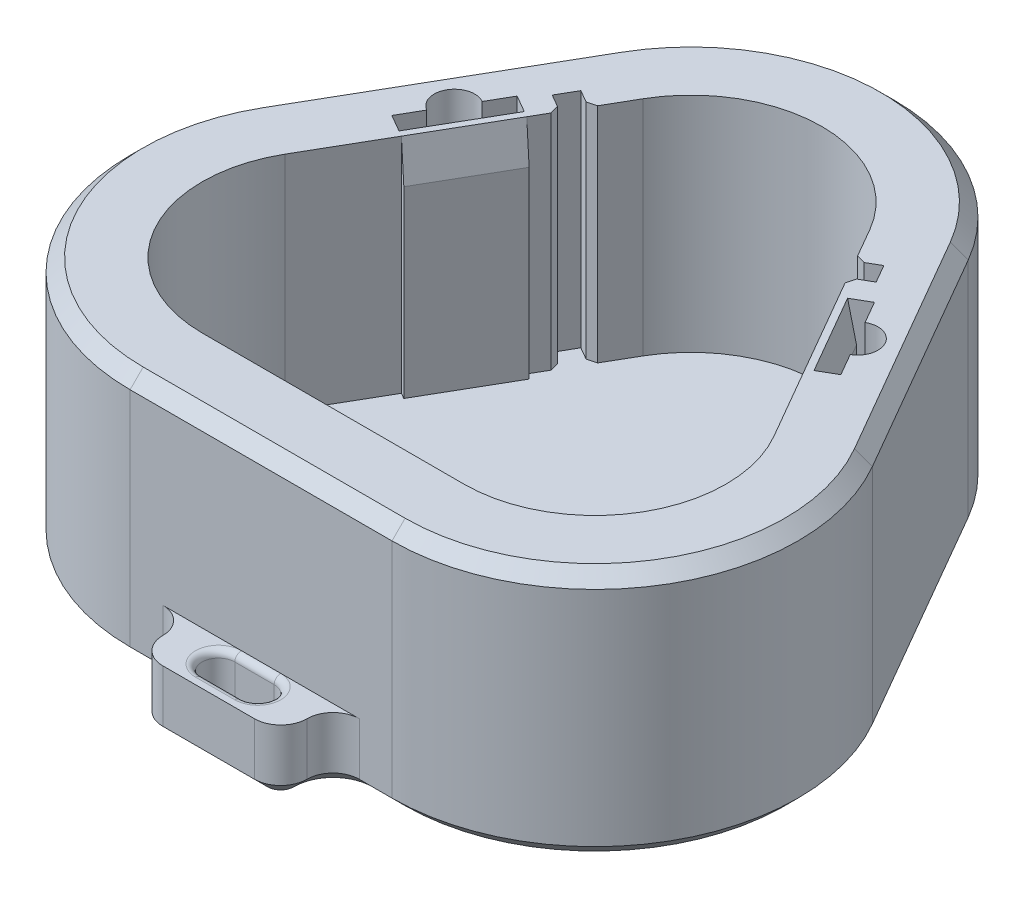
from build123d import *

# Parameters (mm, degrees)
BOSS_EXTRUDE1_DEPTH = 17
CHAMFER1_SIZE       = 0.5
CUT_EXTRUDE1_DEPTH  = 13
BOSS_EXTRUDE2_START = -2
BOSS_EXTRUDE2_DEPTH = 2
SKETCH2_R           = 1.5499999999999992
SKETCH2_R_2         = 1.550000000000003
SKETCH2_R_3         = 2.5
CUT_EXTRUDE2_DEPTH  = 2
BOSS_EXTRUDE3_DEPTH = 5
FILLET1_R           = 2
FILLET2_R           = 0.5
CHAMFER3_SIZE       = 0.5
CHAMFER3_SIZE2      = 3
CHAMFER4_SIZE       = 1


with BuildPart() as part:
    # Sketch1 → Boss-Extrude1 (new body)
    with BuildSketch(Plane(origin=(0, 0, 0), x_dir=(1, 0, 0), z_dir=(0, 1, 0))):
        with BuildLine():
            ThreePointArc((13.418634843133532, 19.2879126019326), (5.33e-15, 27.035165040773038), (-13.418634843133521, 19.287912601932604))
            Line((-13.418634843133521, 19.2879126019326), (-23.413139720814414, 1.9769223572943453))
            ThreePointArc((-23.413139720814414, 1.976922357294347), (-23.413139720814407, -13.517582520386524), (-9.994504877680875, -21.264834959226956))
            Line((-9.994504877680875, -21.264834959226956), (9.994504877680878, -21.26483495922696))
            ThreePointArc((9.994504877680878, -21.26483495922696), (23.413139720814414, -13.517582520386526), (23.41313972081442, 1.9769223572943506))
            Line((23.41313972081442, 1.9769223572943488), (13.418634843133532, 19.2879126019326))
        make_face()
        with BuildLine():
            Line((-11.469734859267339, 10.663506392859015), (-11.902747561159552, 10.91350639285901))
            Line((-11.902747561159554, 10.91350639285901), (-10.975952641916443, 12.518762281184774))
            Line((-10.975952641916448, 12.518762281184776), (-12.361593287971548, 13.318762281184778))
            Line((-12.361593287971548, 13.318762281184778), (-11.561593287971546, 14.70440292723988))
            Line((-11.561593287971546, 14.70440292723988), (-10.17595264191644, 13.904402927239877))
            Line((-10.175952641916442, 13.904402927239877), (-8.655495122319113, 16.537912601932604))
            ThreePointArc((-8.655495122319113, 16.537912601932604), (1.33e-15, 21.535165040773038), (8.655495122319117, 16.537912601932604))
            Line((8.655495122319117, 16.537912601932604), (10.175952641916444, 13.904402927239877))
            Line((10.175952641916444, 13.904402927239877), (11.561593287971549, 14.70440292723988))
            Line((11.561593287971549, 14.70440292723988), (12.361593287971552, 13.318762281184778))
            Line((12.361593287971552, 13.318762281184778), (10.975952641916452, 12.518762281184776))
            Line((10.975952641916447, 12.518762281184772), (11.902747561159558, 10.91350639285901))
            Line((11.902747561159556, 10.913506392859007), (11.46973485926734, 10.663506392859015))
            Line((11.46973485926734, 10.663506392859015), (14.969734859267339, 4.601328566367944))
            Line((14.969734859267339, 4.601328566367944), (15.402747561159552, 4.851328566367944))
            Line((15.402747561159552, 4.8513285663679415), (18.64999999999999, -0.7730776427056512))
            ThreePointArc((18.64999999999999, -0.7730776427056494), (18.65, -10.767582520386522), (9.994504877680878, -15.764834959226958))
            Line((9.994504877680878, -15.76483495922696), (-9.994504877680871, -15.76483495922696))
            ThreePointArc((-9.994504877680868, -15.76483495922696), (-18.64999999999999, -10.767582520386524), (-18.64999999999999, -0.7730776427056494))
            Line((-18.64999999999999, -0.7730776427056512), (-15.402747561159547, 4.851328566367947))
            Line((-15.40274756115955, 4.851328566367947), (-14.969734859267337, 4.601328566367946))
            Line((-14.969734859267337, 4.601328566367946), (-11.469734859267339, 10.663506392859015))
        make_face(mode=Mode.SUBTRACT)
        with BuildLine():
            Line((13.63479836872844, 11.913506392859018), (14.609798368728441, 10.224756855479358))
            ThreePointArc((14.609798368728436, 10.224756855479354), (16.727137744594316, 9.657417479613473), (16.159798368728428, 7.540078103747593))
            Line((16.15979836872844, 7.5400781037476), (17.13479836872844, 5.851328566367942))
            Line((17.13479836872844, 5.851328566367942), (16.268772964944, 5.351328566367942))
            Line((16.268772964944, 5.351328566367942), (12.768772964944, 11.413506392859018))
            Line((12.768772964944, 11.413506392859018), (13.63479836872844, 11.913506392859018))
        make_face(mode=Mode.SUBTRACT)
        with BuildLine():
            Line((-13.634798368728436, 11.913506392859018), (-12.768772964943997, 11.413506392859018))
            Line((-12.768772964943997, 11.413506392859018), (-16.268772964944, 5.351328566367942))
            Line((-16.268772964944, 5.351328566367942), (-17.13479836872844, 5.851328566367942))
            Line((-17.13479836872844, 5.851328566367942), (-16.159798368728442, 7.540078103747597))
            ThreePointArc((-16.159798368728435, 7.540078103747593), (-16.727137744594312, 9.65741747961347), (-14.60979836872844, 10.224756855479354))
            Line((-14.609798368728441, 10.224756855479356), (-13.634798368728436, 11.913506392859018))
        make_face(mode=Mode.SUBTRACT)
    extrude(amount=BOSS_EXTRUDE1_DEPTH)

    # Chamfer1
    chamfer1_edges = [part.edges().sort_by_distance(p)[0] for p in [
        (-10.175952641916442, 8.5, -13.904402927239877),
        (-10.975952641916447, 8.5, -12.518762281184774),
        (10.97595264191645, 8.5, -12.518762281184774),
        (10.175952641916444, 8.5, -13.904402927239877),
    ]]
    chamfer(chamfer1_edges, length=CHAMFER1_SIZE)

    # Sketch1<3> → Cut-Extrude1 (cut)
    with BuildSketch(Plane(origin=(0, 0, 0), x_dir=(1, 0, 0), z_dir=(0, 1, 0))):
        Polygon((-12.585760263051778, 10.7304936909668), (-13.018772964943997, 10.9804936909668), (-13.518772964943999, 10.114468287182358), (-13.085760263051776, 9.86446828718236), align=None)
        Polygon((-15.08576026305178, 6.400366672044599), (-15.518772964944, 6.650366672044602), (-16.018772964944, 5.784341268260162), (-15.585760263051782, 5.53434126826016), align=None)
        Polygon((13.518772964944, 10.114468287182358), (13.018772964944, 10.9804936909668), (12.585760263051782, 10.7304936909668), (13.08576026305178, 9.86446828718236), align=None)
        Polygon((16.018772964944, 5.784341268260162), (15.518772964944, 6.6503666720445995), (15.085760263051784, 6.400366672044599), (15.585760263051785, 5.53434126826016), align=None)
    extrude(amount=CUT_EXTRUDE1_DEPTH, mode=Mode.SUBTRACT)

    # Sketch1<4> → Boss-Extrude2 (add)
    with BuildSketch(Plane(origin=(0, 0, 0), x_dir=(1, 0, 0), z_dir=(0, 1, 0)).offset(BOSS_EXTRUDE2_START)):
        with BuildLine():
            Line((-13.418634843133521, 19.2879126019326), (-23.413139720814414, 1.976922357294346))
            ThreePointArc((-23.413139720814414, 1.976922357294346), (-23.413139720814407, -13.517582520386522), (-9.994504877680875, -21.264834959226956))
            Line((-9.994504877680875, -21.264834959226956), (9.994504877680878, -21.26483495922696))
            ThreePointArc((9.994504877680878, -21.26483495922696), (23.413139720814414, -13.517582520386522), (23.41313972081442, 1.9769223572943484))
            Line((23.41313972081442, 1.9769223572943484), (13.418634843133532, 19.2879126019326))
            ThreePointArc((13.418634843133532, 19.2879126019326), (3.63e-15, 27.035165040773038), (-13.418634843133521, 19.2879126019326))
        make_face()
    extrude(amount=BOSS_EXTRUDE2_DEPTH)

    # Sketch2 → Cut-Extrude2 (cut)
    # profile 1 of 4: a face of its own
    with BuildSketch(Plane.XZ.offset(2)):
        with Locations(Location((-15.384798368728436, -8.882417479613482, 0), (0, 0, 270))):
            Circle(SKETCH2_R)
    # profile 2 of 4: a face of its own
    with BuildSketch(Plane.XZ.offset(2)):
        with Locations(Location((15.38479836872844, -8.882417479613482, 0), (0, 0, 270))):
            Circle(SKETCH2_R_2)
    # profile 3 of 4: a face of its own
    with BuildSketch(Plane.XZ.offset(2)):
        with Locations(Location((0, 0, 0), (0, 0, 270))):
            Circle(SKETCH2_R_3)
    # profile 4 of 4: a face of its own
    with BuildSketch(Plane.XZ.offset(2)):
        Polygon((5.499999999999999, 21.264834959226956), (5.5, 25.264834959226956), (-5.5, 25.264834959226956), (-5.499999999999999, 21.264834959226956), align=None)
        with BuildLine():
            Line((-1.4999999999999987, 24.264834959226945), (1.4999999999999987, 24.264834959226945))
            ThreePointArc((1.4999999999999987, 24.264834959226945), (2.7499999999999916, 23.014834959226953), (1.4999999999999987, 21.76483495922696))
            Line((1.4999999999999987, 21.76483495922696), (-1.4999999999999987, 21.76483495922696))
            ThreePointArc((-1.4999999999999987, 21.76483495922696), (-2.7499999999999916, 23.014834959226953), (-1.4999999999999987, 24.264834959226945))
        make_face(mode=Mode.SUBTRACT)
    extrude(amount=-CUT_EXTRUDE2_DEPTH, mode=Mode.SUBTRACT)

    # Sketch2<2> → Boss-Extrude3 (add)
    with BuildSketch(Plane.XZ.offset(2)):
        Polygon((-5.499999999999999, 21.264834959226956), (5.499999999999999, 21.264834959226956), (5.5, 25.264834959226956), (-5.5, 25.264834959226956), align=None)
        with BuildLine():
            ThreePointArc((-1.499999999999999, 21.76483495922696), (-2.7499999999999916, 23.014834959226953), (-1.4999999999999987, 24.264834959226945))
            Line((-1.4999999999999987, 24.264834959226945), (1.4999999999999987, 24.264834959226945))
            ThreePointArc((1.499999999999999, 24.264834959226945), (2.7499999999999916, 23.014834959226953), (1.4999999999999987, 21.76483495922696))
            Line((1.4999999999999987, 21.76483495922696), (-1.4999999999999987, 21.76483495922696))
        make_face(mode=Mode.SUBTRACT)
    extrude(amount=-BOSS_EXTRUDE3_DEPTH)

    # Fillet1
    fillet1_edges = [part.edges().sort_by_distance(p)[0] for p in [
        (5.499999999999999, 0.5, 21.264834959226956),
        (-5.499999999999999, 0.5, 21.264834959226956),
    ]]
    fillet(fillet1_edges, radius=FILLET1_R)
    fillet1_2_edges = [part.edges().sort_by_distance(p)[0] for p in [
        (5.5, 0.5, 25.264834959226956),
        (-5.5, 0.5, 25.264834959226956),
    ]]
    fillet(fillet1_2_edges, radius=FILLET1_R - 0.0001)  # a hair under: the kernel refuses the full size

    # Fillet2
    fillet2_edges = [part.edges().sort_by_distance(p)[0] for p in [
        (0, 3, 24.264834959226945),
        (2.7499999999999916, 3, 23.014834959226953),
        (-2.7499999999999916, 3, 23.014834959226953),
        (0, 3, 21.76483495922696),
    ]]
    fillet(fillet2_edges, radius=FILLET2_R - 0.0001)  # a hair under: the kernel refuses the full size

    # Chamfer3
    chamfer3_edges = [part.edges().sort_by_distance(p)[0] for p in [
        (13.21973485926734, 17, -7.63241747961348),
        (-13.219734859267337, 17, -7.63241747961348),
        (14.518772964943999, 17, -8.38241747961348),
        (-14.518772964943999, 17, -8.38241747961348),
    ]]
    chamfer3_side = [part.faces().sort_by_distance(p)[0] for p in [
        (-12.172522474712478, 17, -11.850756469441762),
    ]]
    chamfer(chamfer3_edges, length=CHAMFER3_SIZE, length2=CHAMFER3_SIZE2, reference=chamfer3_side[0])

    # Chamfer4
    chamfer4_edges = [part.edges().sort_by_distance(p)[0] for p in [
        (1.78e-15, 17, 21.26483495922696),
        (23.413139720814414, 17, 13.517582520386522),
        (18.415887281973976, 17, -10.632417479613474),
        (4.44e-15, 17, -27.035165040773038),
        (-18.415887281973966, 17, -10.632417479613473),
        (-23.413139720814407, 17, 13.517582520386526),
        (5.33e-15, -2, -27.035165040773038),
        (23.413139720814414, -2, 13.517582520386526),
        (-8.747252438840437, -2, 21.264834959226956),
        (-23.413139720814407, -2, 13.517582520386524),
        (-18.415887281973966, -2, -10.632417479613473),
        (18.415887281973976, -2, -10.632417479613474),
        (8.747252438840441, -2, 21.26483495922696),
        (0, -2, 25.264834959226956),
        (-4.9142428516949765, -2, 24.67907781092193),
        (4.914242851694976, -2, 24.67907781092193),
        (6.085786437626905, -2, 21.850621396853864),
        (-6.085786437626905, -2, 21.85062139685386),
    ]]
    chamfer(chamfer4_edges, length=CHAMFER4_SIZE - 0.0001)  # a hair under: the kernel refuses the full size


solid = part.part
